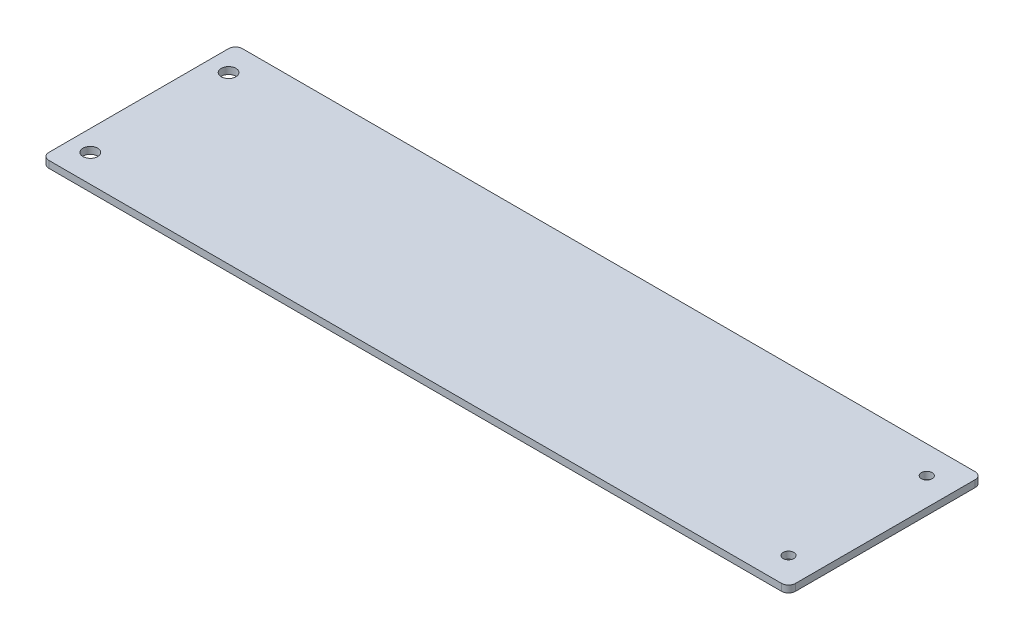
from build123d import *

# Parameters (mm, degrees)
SKETCH1_W                        = 342.9
SKETCH1_H                        = 88.9
BOSS_EXTRUDE1_DEPTH              = 3.175
F_17_64_0_26563_DIAMETER_HOLE1_D = 6.747002
F_10_0_1935_DIAMETER_HOLE1_D     = 4.9149
FILLET1_R                        = 3.175


with BuildPart() as part:
    # Sketch1 → Boss-Extrude1 (new body)
    with BuildSketch(Plane(origin=(0, 0, 0), x_dir=(1, 0, 0), z_dir=(0, 1, 0))):
        Rectangle(SKETCH1_W, SKETCH1_H)
    extrude(amount=BOSS_EXTRUDE1_DEPTH)

    # 17/64 (0.26563) Diameter Hole1 (through all)
    with Locations(Plane(origin=(0, 3.175, 0), x_dir=(1, 0, 0), z_dir=(0, 1, 0))):
        with Locations((-161.925, 31.75), (-161.925, -31.75)):
            Hole(F_17_64_0_26563_DIAMETER_HOLE1_D / 2)

    # #10 (0.1935) Diameter Hole1 (through all)
    with Locations(Plane(origin=(0, 3.175, 0), x_dir=(1, 0, 0), z_dir=(0, 1, 0))):
        with Locations((158.75, 31.75), (158.75, -31.75)):
            Hole(F_10_0_1935_DIAMETER_HOLE1_D / 2)

    # Fillet1
    fillet1_edges = [part.edges().sort_by_distance(p)[0] for p in [
        (-171.45, 1.5875, -44.45),
        (-171.45, 1.5875, 44.45),
        (171.45, 1.5875, 44.45),
        (171.45, 1.5875, -44.45),
    ]]
    fillet(fillet1_edges, radius=FILLET1_R)


solid = part.part
